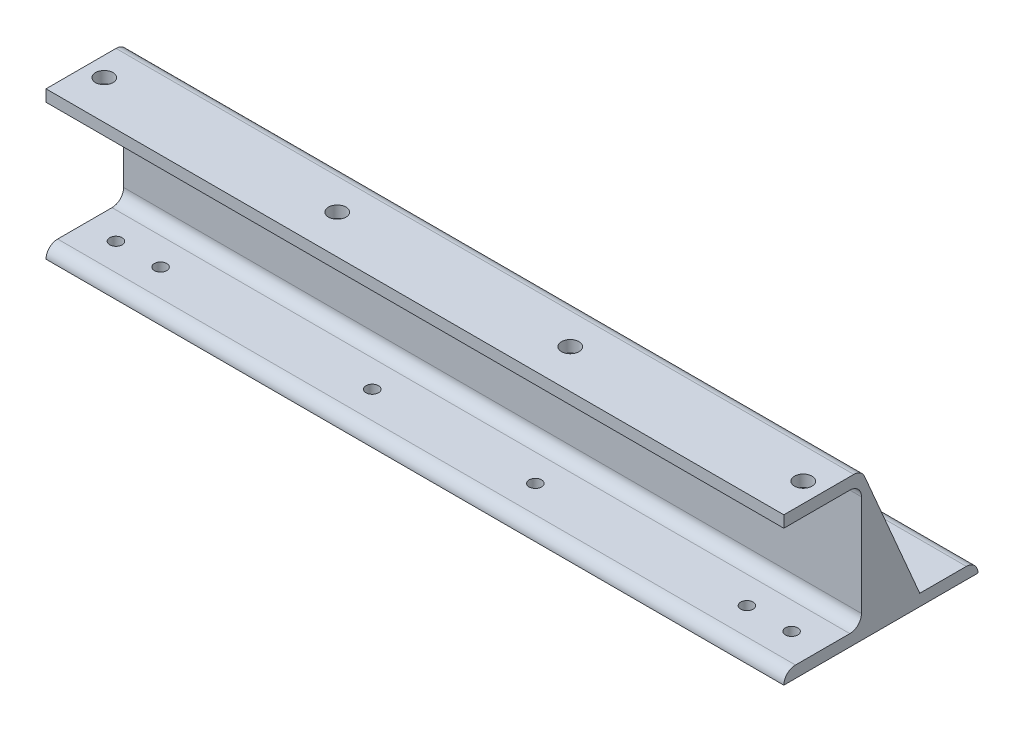
from build123d import *

# Parameters (mm, degrees)
BOSS_EXTRUDE1_DEPTH = 190
SKETCH2_R           = 2.25
CUT_EXTRUDE1_DEPTH  = 3
SKETCH3_R           = 1.6
CUT_EXTRUDE2_DEPTH  = 3
SKETCH4_R           = 3.75
SKETCH4_R_2         = 1.5
CUT_EXTRUDE3_DEPTH  = 3
FILLET1_R           = 3


with BuildPart() as part:
    # Sketch1 → Boss-Extrude1 (new body)
    with BuildSketch(Plane(origin=(0, 0, 0), x_dir=(0, 0, -1), z_dir=(1, 0, 0))):
        Polygon((0, 0), (-20, 0), (-20, -3), (0, -3), (0, -35), (-20, -35), (-20, -38), (30, -38), (30, -35), (15, -35), align=None)
    extrude(amount=-BOSS_EXTRUDE1_DEPTH)

    # Sketch2 → Cut-Extrude1 (cut)
    with BuildSketch(Plane(origin=(0, 0, 0), x_dir=(1, 0, 0), z_dir=(0, 1, 0))):
        with Locations(Location((-185, -10, 0), (0, 0, 270))):
            Circle(SKETCH2_R)
        with Locations(Location((-125, -10, 0), (0, 0, 270))):
            Circle(SKETCH2_R)
        with Locations(Location((-65, -10, 0), (0, 0, 270))):
            Circle(SKETCH2_R)
        with Locations(Location((-5, -10, 0), (0, 0, 270))):
            Circle(SKETCH2_R)
    extrude(amount=-CUT_EXTRUDE1_DEPTH, mode=Mode.SUBTRACT)

    # Sketch3 → Cut-Extrude2 (cut)
    with BuildSketch(Plane.XZ.offset(38)):
        with Locations(Location((-116, 10, 0), (0, 0, 270))):
            Circle(SKETCH3_R)
        with Locations(Location((-74, 10, 0), (0, 0, 270))):
            Circle(SKETCH3_R)
        with Locations(Location((-182, 10, 0), (0, 0, 270))):
            Circle(SKETCH3_R)
        with Locations(Location((-170.5, 10, 0), (0, 0, 270))):
            Circle(SKETCH3_R)
        with Locations(Location((-19.5, 10, 0), (0, 0, 270))):
            Circle(SKETCH3_R)
        with Locations(Location((-8, 10, 0), (0, 0, 270))):
            Circle(SKETCH3_R)
    extrude(amount=-CUT_EXTRUDE2_DEPTH, mode=Mode.SUBTRACT)

    # Sketch4 → Cut-Extrude3 (cut)
    with BuildSketch(Plane(origin=(0, -35, 0), x_dir=(1, 0, 0), z_dir=(0, 1, 0))):
        with Locations(Location((-140, 21.5, 0), (0, 0, 270))):
            Circle(SKETCH4_R)
        with Locations(Location((-147.8, 21.5, 0), (0, 0, 270))):
            Circle(SKETCH4_R_2)
    extrude(amount=-CUT_EXTRUDE3_DEPTH, mode=Mode.SUBTRACT)

    # Fillet1
    fillet1_edges = [part.edges().sort_by_distance(p)[0] for p in [
        (-95, -35, 0),
        (-95, -3, 0),
        (-95, -35, -30),
        (-95, -35, 20),
        (-95, 0, 0),
    ]]
    fillet(fillet1_edges, radius=FILLET1_R - 0.0001)  # a hair under: the kernel refuses the full size


solid = part.part
